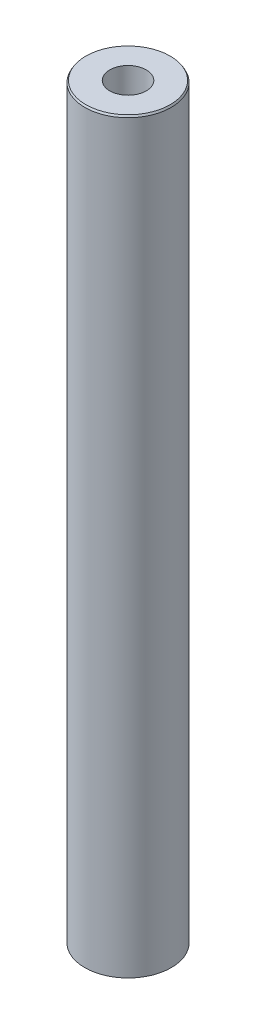
from build123d import *
from OCP.BRepFilletAPI import BRepFilletAPI_MakeChamfer

# Parameters (mm, degrees)
SKETCH1_R           = 5
BOSS_EXTRUDE1_DEPTH = 86.535159986
SKETCH2_R           = 2.111043348
CUT_EXTRUDE1_DEPTH  = 87.82357925
CHAMFER1_SIZE       = 0.211961411
CHAMFER1_SIZE2      = 0.122375978


with BuildPart() as part:
    # Sketch1 → Boss-Extrude1 (new body)
    with BuildSketch(Plane(origin=(0, 0, 0), x_dir=(1, 0, 0), z_dir=(0, 1, 0))):
        Circle(SKETCH1_R)
    extrude(amount=BOSS_EXTRUDE1_DEPTH)

    # Sketch2 → Cut-Extrude1 (cut, through all)
    with BuildSketch(Plane(origin=(0, 0, 0), x_dir=(1, 0, 0), z_dir=(0, 1, 0))):
        Circle(SKETCH2_R)
    extrude(amount=CUT_EXTRUDE1_DEPTH, mode=Mode.SUBTRACT)

    # Chamfer1: one chamfer whose edges measure the first distance from different faces: ONE call of the kernel's chamfer builder (chamfer() names one face for all edges)
    chamfer1_edges_1 = [part.edges().sort_by_distance(p)[0] for p in [
        (-5, 86.535159986, 0),
    ]]
    chamfer1_side_1 = [part.faces().sort_by_distance(p)[0] for p in [
        (-5, 43.267579993, 0),
    ]]
    chamfer1_edges_2 = [part.edges().sort_by_distance(p)[0] for p in [
        (-5, 0, 0),
    ]]
    chamfer1_side_2 = [part.faces().sort_by_distance(p)[0] for p in [
        (-4.858578644, 0, 0),
    ]]
    chamfer1 = BRepFilletAPI_MakeChamfer(part.part.solid().wrapped)
    for e in chamfer1_edges_1:
        chamfer1.Add(CHAMFER1_SIZE, CHAMFER1_SIZE2, e.wrapped, chamfer1_side_1[0].wrapped)  # the first distance lies on this face
    for e in chamfer1_edges_2:
        chamfer1.Add(CHAMFER1_SIZE, CHAMFER1_SIZE2, e.wrapped, chamfer1_side_2[0].wrapped)  # the first distance lies on this face
    add(Compound.cast(chamfer1.Shape()), mode=Mode.REPLACE)


solid = part.part
